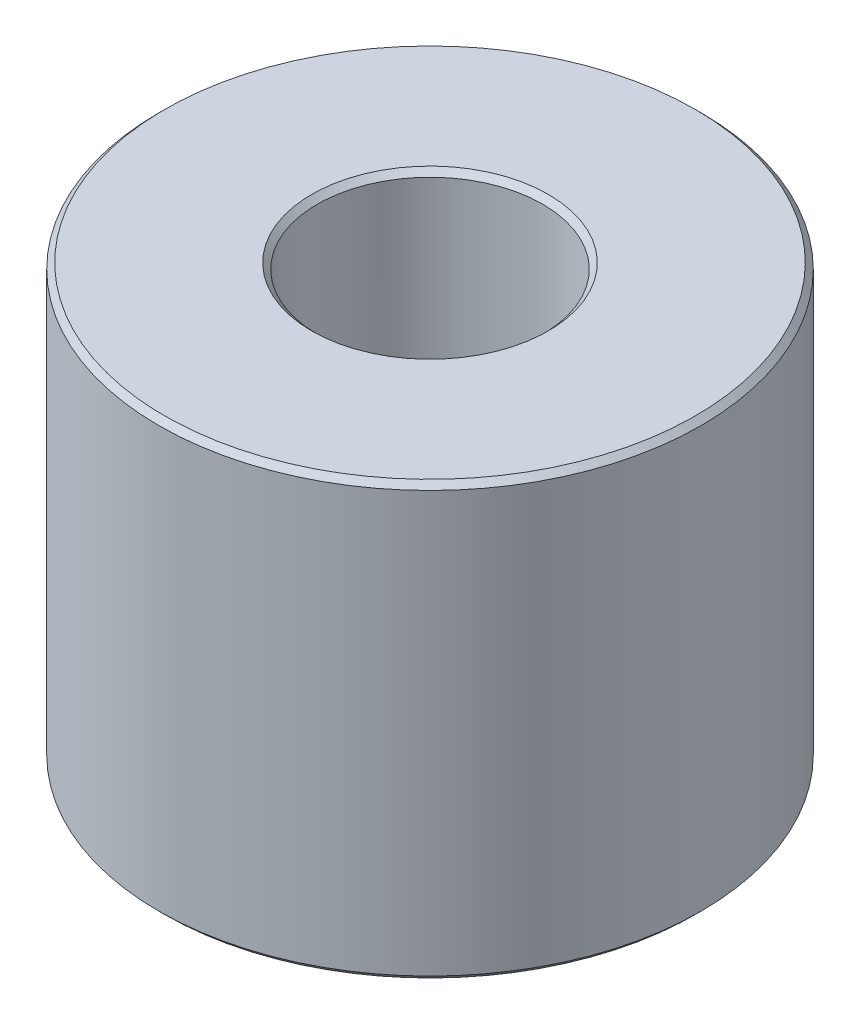
from build123d import *

# Parameters (mm, degrees)
SKETCH1_R           = 45
BOSS_EXTRUDE1_DEPTH = 71.703048344
SKETCH2_R           = 18.705307846
CUT_EXTRUDE1_DEPTH  = 96.871409408
CHAMFER1_SIZE       = 0.938488548


with BuildPart() as part:
    # Sketch1 → Boss-Extrude1 (new body)
    with BuildSketch(Plane(origin=(0, 0, 0), x_dir=(1, 0, 0), z_dir=(0, 1, 0))):
        Circle(SKETCH1_R)
    extrude(amount=BOSS_EXTRUDE1_DEPTH)

    # Sketch2 → Cut-Extrude1 (cut, through all)
    with BuildSketch(Plane(origin=(0, 0, 0), x_dir=(1, 0, 0), z_dir=(0, 1, 0))):
        Circle(SKETCH2_R)
    extrude(amount=CUT_EXTRUDE1_DEPTH, mode=Mode.SUBTRACT)

    # Chamfer1
    chamfer1_edges = [part.edges().sort_by_distance(p)[0] for p in [
        (-18.705307846, 71.703048344, 0),
        (-18.705307846, 0, 0),
        (-45, 0, 0),
        (-45, 71.703048344, 0),
    ]]
    chamfer(chamfer1_edges, length=CHAMFER1_SIZE)


solid = part.part
